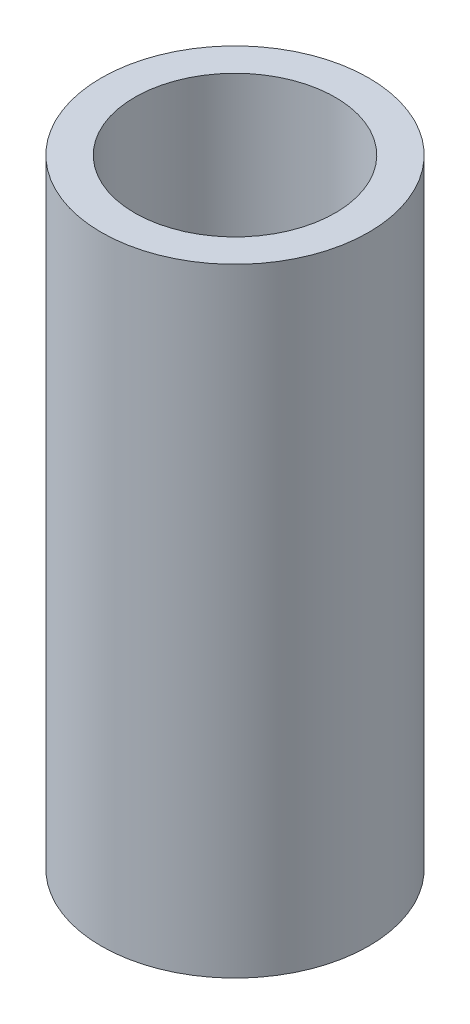
from build123d import *

# Parameters (mm, degrees)
SKETCH1_R           = 10
BOSS_EXTRUDE1_DEPTH = 46.211168023
SKETCH2_R           = 7.495003968
CUT_EXTRUDE1_DEPTH  = 49.326721904


with BuildPart() as part:
    # Sketch1 → Boss-Extrude1 (new body)
    with BuildSketch(Plane(origin=(0, 0, 0), x_dir=(1, 0, 0), z_dir=(0, 1, 0))):
        Circle(SKETCH1_R)
    extrude(amount=BOSS_EXTRUDE1_DEPTH)

    # Sketch2 → Cut-Extrude1 (cut, through all)
    with BuildSketch(Plane(origin=(0, 0, 0), x_dir=(1, 0, 0), z_dir=(0, 1, 0))):
        Circle(SKETCH2_R)
    extrude(amount=CUT_EXTRUDE1_DEPTH, mode=Mode.SUBTRACT)


solid = part.part
